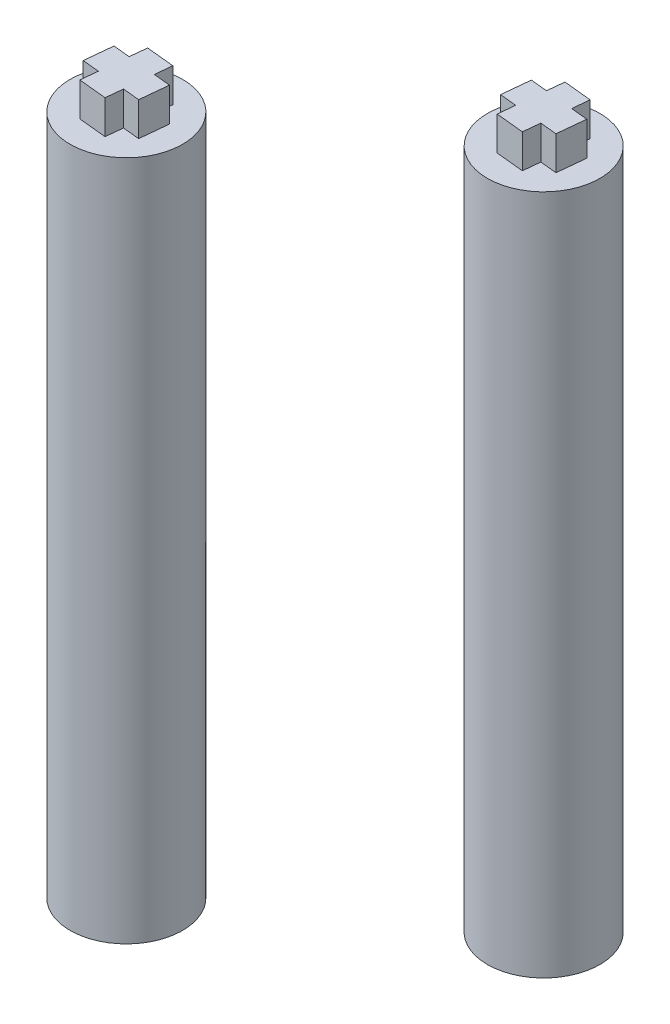
from build123d import *

# Parameters (mm, degrees)
SKETCH_1_R               = 5
EXTRUDE_1_DEPTH          = 2
EXTRUDE_2_DEPTH          = 3.5
EXTRUDE_3_DEPTH          = 3.5
SKETCH_4_R               = 5
EXTRUDE_4_DEPTH          = 0.5
CUT_EXTRUDE_2_DEPTH      = 3
CUT_EXTRUDE_3_DEPTH      = 2
EXTRUDE_5_DEPTH          = 58
SKETCH_8_R               = 5
EXTRUDE_6_DEPTH          = 58
CUT_EXTRUDE_4_DEPTH      = 8
SKETCH_10_R              = 1.5
CUT_EXTRUDE_5_DEPTH      = 15
SKETCH_11_R              = 3.5
CUT_EXTRUDE_6_DEPTH      = 30
SKETCH_12_R              = 1
CUT_EXTRUDE_7_DEPTH      = 7
SKETCH_13_R              = 3.5
SKETCH_14_R              = 1
SKETCH_18_R              = 13.241072342
EXTRUDE_8_DEPTH          = 1
SKETCH_22_R              = 1.202046813
EXTRUDE_9_DEPTH          = 10
PATTERN_CIRCULAR_2_COUNT = 2
CUT_EXTRUDE_START        = -1
SKETCH_23_R              = 13.241072342
CUT_EXTRUDE_8_DEPTH      = 1
SKETCH_24_R              = 2.250567035
CUT_EXTRUDE_9_DEPTH      = 10


# Read off the part's stored shape, not the designer's step: 切除-扫描1
with BuildPart() as part:
    # 草图1 → 凸台-拉伸1 (new body)
    with BuildSketch(Plane(origin=(0, 0, 0), x_dir=(1, 0, 0), z_dir=(0, 1, 0))):
        with Locations(Location((0, 0, 0), (0, 0, 270))):
            Circle(SKETCH_1_R)
        Polygon((2.55392077, -1.838021228), (2.868733461, 1.292749652), (0.314812691, 3.13077088), (-2.55392077, 1.838021228), (-2.868733461, -1.292749652), (-0.314812691, -3.13077088), align=None, mode=Mode.SUBTRACT)
    extrude_1 = extrude(amount=EXTRUDE_1_DEPTH)

    # 草图2 → 凸台-拉伸2 (add)
    with BuildSketch(Plane(origin=(0, 2, 0), x_dir=(1, 0, 0), z_dir=(0, 1, 0))):
        Polygon((-2.834872538, 1.792623133), (3.135022029, 1.192324151), (2.834872538, -1.792623133), (-3.135022029, -1.192324151), align=None)
    extrude_2 = extrude(amount=EXTRUDE_2_DEPTH)

    # 草图3 → 凸台-拉伸3 (add)
    with BuildSketch(Plane(origin=(0, 2, 0), x_dir=(1, 0, 0), z_dir=(0, 1, 0))):
        Polygon((-1.192324151, 3.135022029), (-1.792623133, -2.834872538), (1.192324151, -3.135022029), (1.792623133, 2.834872538), align=None)
    extrude_3 = extrude(amount=EXTRUDE_3_DEPTH)

    # 草图4 → 凸台-拉伸4 (add)
    with BuildSketch(Plane(origin=(0, 2, 0), x_dir=(1, 0, 0), z_dir=(0, 1, 0))):
        with Locations(Location((0, 0, 0), (0, 0, 270))):
            Circle(SKETCH_4_R)
    extrude_4 = extrude(amount=EXTRUDE_4_DEPTH)

    # 草图5 → 切除-拉伸2 (cut)
    with BuildSketch(Plane(origin=(0, 5.5, 0), x_dir=(1, 0, 0), z_dir=(0, 1, 0))):
        Polygon((-3.135022029, -1.192324151), (-2.834872538, 1.792623133), (-1.342398896, 1.642548387), (-1.192324151, 3.135022029), (1.792623133, 2.834872538), (1.642548387, 1.342398896), (3.135022029, 1.192324151), (2.834872538, -1.792623133), (1.342398896, -1.642548387), (1.192324151, -3.135022029), (-1.792623133, -2.834872538), (-1.642548387, -1.342398896), align=None)
        Polygon((-1.093653289, 1.617535929), (-0.968591001, 2.861263964), (1.518865068, 2.611139388), (1.39380278, 1.367411354), (1.368790323, 1.118665747), (1.617535929, 1.093653289), (2.861263964, 0.968591001), (2.611139388, -1.518865068), (1.367411354, -1.39380278), (1.118665747, -1.368790323), (1.093653289, -1.617535929), (0.968591001, -2.861263964), (-1.518865068, -2.611139388), (-1.39380278, -1.367411354), (-1.368790323, -1.118665747), (-1.617535929, -1.093653289), (-2.861263964, -0.968591001), (-2.611139388, 1.518865068), (-1.367411354, 1.39380278), (-1.118665747, 1.368790323), align=None, mode=Mode.SUBTRACT)
    cut_extrude_2 = extrude(amount=-CUT_EXTRUDE_2_DEPTH, mode=Mode.SUBTRACT)

    # 草图6 → 切除-拉伸3 (cut)
    with BuildSketch(Plane.XZ):
        Polygon((2.888759724, -1.318484202), (2.586220675, 1.842497205), (-0.302539048, 3.160981407), (-2.888759724, 1.318484202), (-2.586220675, -1.842497205), (0.302539048, -3.160981407), align=None)
    cut_extrude_3 = extrude(amount=-CUT_EXTRUDE_3_DEPTH, mode=Mode.SUBTRACT)

    # 草图7 → 凸台-拉伸5 (add)
    with BuildSketch(Plane(origin=(0, 5.5, 0), x_dir=(1, 0, 0), z_dir=(0, 1, 0))):
        Polygon((-1.118665747, 1.368790323), (-0.968591001, 2.861263964), (1.518865068, 2.611139388), (1.368790323, 1.118665747), (2.861263964, 0.968591001), (2.611139388, -1.518865068), (1.118665747, -1.368790323), (0.968591001, -2.861263964), (-1.518865068, -2.611139388), (-1.368790323, -1.118665747), (-2.861263964, -0.968591001), (-2.611139388, 1.518865068), align=None)
    extrude_5 = extrude(amount=EXTRUDE_5_DEPTH)

    # 草图8 → 凸台-拉伸6 (add)
    with BuildSketch(Plane(origin=(0, 2.5, 0), x_dir=(1, 0, 0), z_dir=(0, 1, 0))):
        with Locations(Location((0, 0, 0), (0, 0, 270))):
            Circle(SKETCH_8_R)
    extrude_6 = extrude(amount=EXTRUDE_6_DEPTH)

    # 草图9 → 切除-拉伸4 (cut)
    with BuildSketch(Plane.XZ):
        Polygon((2.888759724, -1.318484202), (2.586220675, 1.842497205), (-0.302539048, 3.160981407), (-2.888759724, 1.318484202), (-2.586220675, -1.842497205), (0.302539048, -3.160981407), align=None)
    cut_extrude_4 = extrude(amount=-CUT_EXTRUDE_4_DEPTH, mode=Mode.SUBTRACT)

    # 草图10 → 切除-拉伸5 (cut)
    with BuildSketch(Plane.XZ.offset(-8)):
        with Locations(Location((0, 0, 0), (0, 0, 270))):
            Circle(SKETCH_10_R)
    cut_extrude_5 = extrude(amount=-CUT_EXTRUDE_5_DEPTH, mode=Mode.SUBTRACT)

    # 草图11 → 切除-拉伸6 (cut)
    with BuildSketch(Plane.XZ.offset(-23)):
        with Locations(Location((0, 0, 0), (0, 0, 270))):
            Circle(SKETCH_11_R)
    cut_extrude_6 = extrude(amount=-CUT_EXTRUDE_6_DEPTH, mode=Mode.SUBTRACT)

    # 草图12 → 切除-拉伸7 (cut)
    with BuildSketch(Plane.XZ.offset(-53)):
        with Locations(Location((0, 0, 0), (0, 0, 270))):
            Circle(SKETCH_12_R)
    cut_extrude_7 = extrude(amount=-CUT_EXTRUDE_7_DEPTH, mode=Mode.SUBTRACT)

    # 草图13 → 放样1 section 0
    with BuildSketch(Plane.XZ.offset(-53)):
        Circle(SKETCH_13_R)
    # 草图14 → 放样1 section 1
    with BuildSketch(Plane.XZ.offset(-60)):
        Circle(SKETCH_14_R)
    loft_1 = loft()

    # 切除-扫描1 outline → 切除-扫描1 (revolve, cut)
    with BuildSketch(Plane.XY):
        Polygon((3.5, 53), (0, 60.5), (0, 53), align=None)
    sweep_1 = revolve(axis=Axis((0, 0, 0), (0, 1, 0)), mode=Mode.SUBTRACT)

    # 草图18 → 凸台-拉伸8 (add)
    with BuildSketch(Plane(origin=(0, 0, 0), x_dir=(1, 0, 0), z_dir=(0, 1, 0))):
        with Locations(Location((-10.582177215, -7.958864376, 0), (0, 0, 270))):
            Circle(SKETCH_18_R)
    extrude(amount=-EXTRUDE_8_DEPTH)

    # 草图22 → 凸台-拉伸9 (add)
    with BuildSketch(Plane(origin=(0, 0, 0), x_dir=(1, 0, 0), z_dir=(0, 1, 0))):
        with Locations(Location((-10.582177215, -7.958864376, 0), (0, 0, 270))):
            Circle(SKETCH_22_R)
    extrude(amount=EXTRUDE_9_DEPTH)

    # 阵列(圆周)2: 凸台-拉伸1, 凸台-拉伸2, 凸台-拉伸3, 凸台-拉伸4, 切除-拉伸2, 切除-拉伸3, 凸台-拉伸5, 凸台-拉伸6, 切除-拉伸4, 切除-拉伸5, 切除-拉伸6, 切除-拉伸7, 放样1, 切除-扫描1 ×2 about axis
    pattern_circular_2_axis = Axis((-10.582177215, 0, 7.958864376), (0, 1, 0))
    add([extrude_1.rotate(pattern_circular_2_axis, i * 360 / PATTERN_CIRCULAR_2_COUNT) for i in range(1, PATTERN_CIRCULAR_2_COUNT)])
    add([extrude_2.rotate(pattern_circular_2_axis, i * 360 / PATTERN_CIRCULAR_2_COUNT) for i in range(1, PATTERN_CIRCULAR_2_COUNT)])
    add([extrude_3.rotate(pattern_circular_2_axis, i * 360 / PATTERN_CIRCULAR_2_COUNT) for i in range(1, PATTERN_CIRCULAR_2_COUNT)])
    add([extrude_4.rotate(pattern_circular_2_axis, i * 360 / PATTERN_CIRCULAR_2_COUNT) for i in range(1, PATTERN_CIRCULAR_2_COUNT)])
    add([cut_extrude_2.rotate(pattern_circular_2_axis, i * 360 / PATTERN_CIRCULAR_2_COUNT) for i in range(1, PATTERN_CIRCULAR_2_COUNT)], mode=Mode.SUBTRACT)
    add([cut_extrude_3.rotate(pattern_circular_2_axis, i * 360 / PATTERN_CIRCULAR_2_COUNT) for i in range(1, PATTERN_CIRCULAR_2_COUNT)], mode=Mode.SUBTRACT)
    add([extrude_5.rotate(pattern_circular_2_axis, i * 360 / PATTERN_CIRCULAR_2_COUNT) for i in range(1, PATTERN_CIRCULAR_2_COUNT)])
    add([extrude_6.rotate(pattern_circular_2_axis, i * 360 / PATTERN_CIRCULAR_2_COUNT) for i in range(1, PATTERN_CIRCULAR_2_COUNT)])
    add([cut_extrude_4.rotate(pattern_circular_2_axis, i * 360 / PATTERN_CIRCULAR_2_COUNT) for i in range(1, PATTERN_CIRCULAR_2_COUNT)], mode=Mode.SUBTRACT)
    add([cut_extrude_5.rotate(pattern_circular_2_axis, i * 360 / PATTERN_CIRCULAR_2_COUNT) for i in range(1, PATTERN_CIRCULAR_2_COUNT)], mode=Mode.SUBTRACT)
    add([cut_extrude_6.rotate(pattern_circular_2_axis, i * 360 / PATTERN_CIRCULAR_2_COUNT) for i in range(1, PATTERN_CIRCULAR_2_COUNT)], mode=Mode.SUBTRACT)
    add([cut_extrude_7.rotate(pattern_circular_2_axis, i * 360 / PATTERN_CIRCULAR_2_COUNT) for i in range(1, PATTERN_CIRCULAR_2_COUNT)], mode=Mode.SUBTRACT)
    add([loft_1.rotate(pattern_circular_2_axis, i * 360 / PATTERN_CIRCULAR_2_COUNT) for i in range(1, PATTERN_CIRCULAR_2_COUNT)])
    add([sweep_1.rotate(pattern_circular_2_axis, i * 360 / PATTERN_CIRCULAR_2_COUNT) for i in range(1, PATTERN_CIRCULAR_2_COUNT)], mode=Mode.SUBTRACT)

    # 草图23 → 切除-拉伸8 (cut)
    with BuildSketch(Plane.XZ.offset(1).offset(CUT_EXTRUDE_START)):
        with Locations((-10.582177215, 7.958864376)):
            Circle(SKETCH_23_R)
    extrude(amount=CUT_EXTRUDE_8_DEPTH, mode=Mode.SUBTRACT)


with BuildPart() as cut_extrude_8_piece_1:
    # of the separate pieces the step leaves, piece 1, a body of its own (cut_extrude_8_pieces)
    add(part.part.solids().sort_by_distance((0, 60.5, 5))[0])


with BuildPart() as cut_extrude_8_piece_2:
    # of the separate pieces the step leaves, piece 2, a body of its own (cut_extrude_8_pieces)
    add(part.part.solids().sort_by_distance((-21.16435443, 0, 10.917728752))[0])


with BuildPart() as cut_extrude_8_piece_3:
    # of the separate pieces the step leaves, piece 3, a body of its own (cut_extrude_8_pieces)
    add(part.part.solids().sort_by_distance((-10.582177215, 0, 9.160911189))[0])

    # 草图24 → 切除-拉伸9 (cut)
    with BuildSketch(Plane.XZ):
        with Locations((-10.582177215, 7.958864376)):
            Circle(SKETCH_24_R)
    extrude(amount=-CUT_EXTRUDE_9_DEPTH, mode=Mode.SUBTRACT)


solid = Compound([cut_extrude_8_piece_1.part, cut_extrude_8_piece_2.part])
